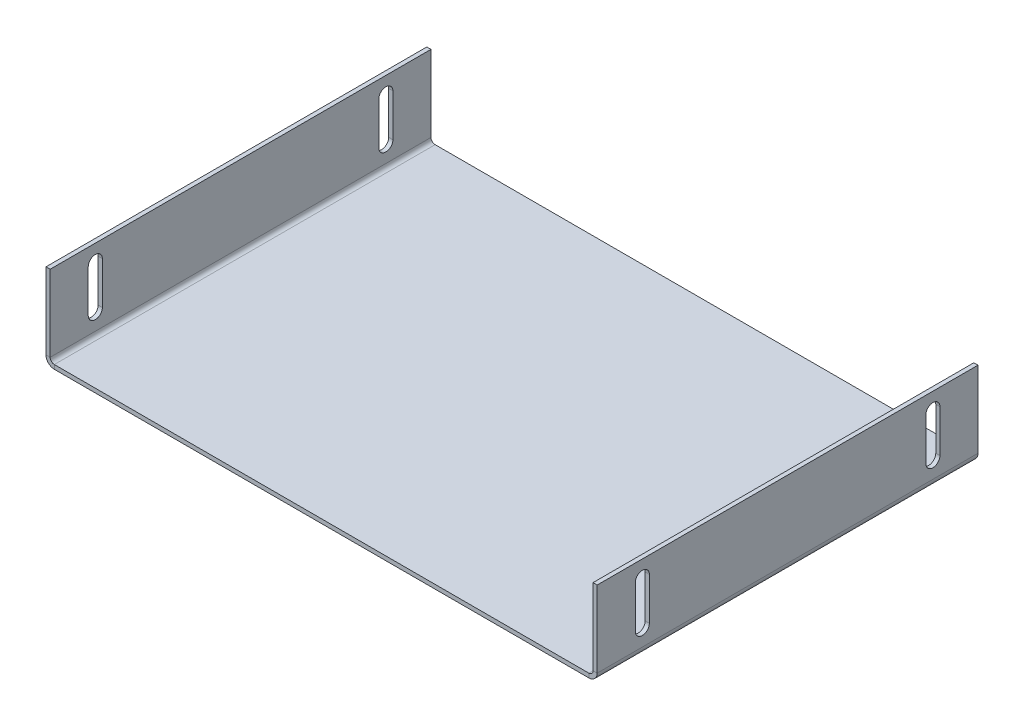
from build123d import *

# Parameters (mm, degrees)
SKETCH1_W               = 94.2208
SKETCH1_H               = 67.5
BASE_FLANGE1_DEPTH      = 0.7366
EDGE_FLANGE1_DEPTH      = 67.5
EDGE_FLANGE1_BEND_DEPTH = 67.5
CUT_EXTRUDE1_DEPTH      = 105.682033016


# Sheet-metal steps are written as plain solids
with BuildPart() as part:
    # Sketch1 → Base-Flange1 (new body)
    with BuildSketch(Plane(origin=(0, 0, 0), x_dir=(1, 0, 0), z_dir=(0, 1, 0))):
        with Locations((0, -1.046060421)):
            Rectangle(SKETCH1_W, SKETCH1_H)
    extrude(amount=-BASE_FLANGE1_DEPTH)

    # Edge-Flange1 section (across the edge) → Edge-Flange1 (add)
    with BuildSketch(Plane(origin=(48.1104, 0, 34.796060421), x_dir=(-1, 0, 0), z_dir=(0, 0, -1))):
        with BuildLine():
            Line((-0.7366, 0.7366), (-0.7366, 14.2634))
            Line((-0.7366, 14.2634), (0, 14.2634))
            Line((0, 14.2634), (0, 0.7366))
            ThreePointArc((0, 0.7366), (0.215745145, 0.215745145), (0.7366, 0))
            Line((0.7366, 0), (1, 0))
            Line((1, 0), (1, -0.7366))
            Line((1, -0.7366), (0.7366, -0.7366))
            ThreePointArc((0.7366, -0.7366), (-0.30510971, -0.30510971), (-0.7366, 0.7366))
        make_face()
    extrude(amount=EDGE_FLANGE1_DEPTH)

    # Edge-Flange1 section 2 (across the edge) → Edge-Flange1 bend (add)
    with BuildSketch(Plane(origin=(-48.1104, 0, -32.703939579), x_dir=(1, 0, 0), z_dir=(0, 0, 1))):
        with BuildLine():
            Line((-0.7366, 0.7366), (-0.7366, 14.2634))
            Line((-0.7366, 14.2634), (0, 14.2634))
            Line((0, 14.2634), (0, 0.7366))
            ThreePointArc((0, 0.7366), (0.215745145, 0.215745145), (0.7366, 0))
            Line((0.7366, 0), (1, 0))
            Line((1, 0), (1, -0.7366))
            Line((1, -0.7366), (0.7366, -0.7366))
            ThreePointArc((0.7366, -0.7366), (-0.30510971, -0.30510971), (-0.7366, 0.7366))
        make_face()
    extrude(amount=EDGE_FLANGE1_BEND_DEPTH)

    # Sketch13 → Cut-Extrude1 (cut, through all)
    with BuildSketch(Plane.ZY.offset(48.847)):
        with BuildLine():
            Line((28.046060421, 11.2634), (28.046060421, 3.7634))
            ThreePointArc((28.046060421, 3.7634), (26.796060421, 2.5134), (25.546060421, 3.7634))
            Line((25.546060421, 3.7634), (25.546060421, 11.2634))
            ThreePointArc((25.546060421, 11.2634), (26.796060421, 12.5134), (28.046060421, 11.2634))
        make_face()
        with BuildLine():
            Line((-23.453939579, 11.2634), (-23.453939579, 3.7634))
            ThreePointArc((-23.453939579, 3.7634), (-24.703939579, 2.5134), (-25.953939579, 3.7634))
            Line((-25.953939579, 3.7634), (-25.953939579, 11.2634))
            ThreePointArc((-25.953939579, 11.2634), (-24.703939579, 12.5134), (-23.453939579, 11.2634))
        make_face()
    extrude(amount=-CUT_EXTRUDE1_DEPTH, mode=Mode.SUBTRACT)


solid = part.part
